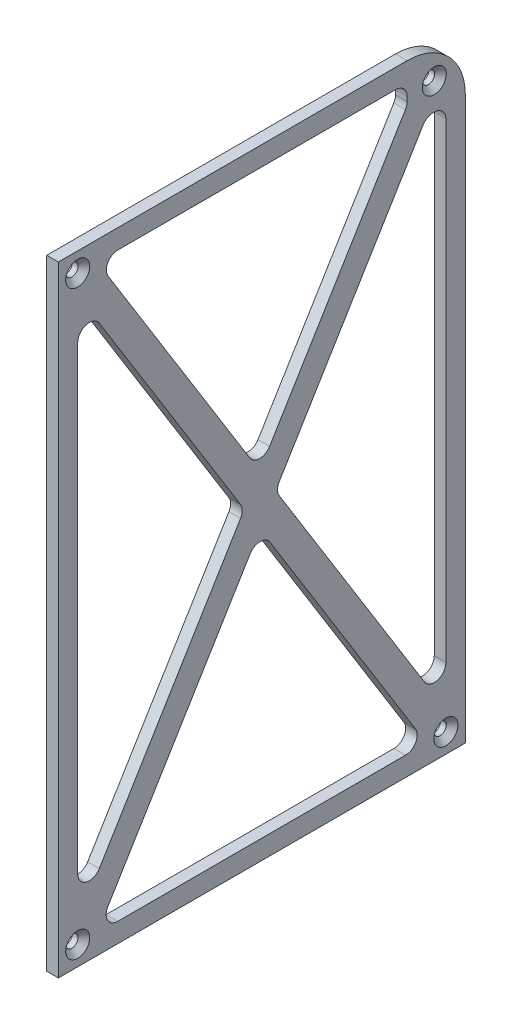
from build123d import *

# Parameters (mm, degrees)
SKETCH1_R           = 1.6
BOSS_EXTRUDE2_DEPTH = 3
FILLET1_R           = 3
CHAMFER1_SIZE       = 1.5


with BuildPart() as part:
    # Sketch1 → Boss-Extrude2 (new body)
    with BuildSketch(Plane(origin=(0, 0, 0), x_dir=(0, 0, -1), z_dir=(1, 0, 0))):
        with BuildLine():
            Line((0, 160), (0, 0))
            Line((0, 0), (105, 0))
            Line((105, 0), (105, 145))
            ThreePointArc((105, 145), (100.606601718, 155.606601718), (90, 160))
            Line((90, 160), (0, 160))
        make_face()
        with BuildLine():
            ThreePointArc((6.6, 5), (3.86862915, 3.86862915), (5, 6.6))
            ThreePointArc((5, 6.6), (6.13137085, 6.13137085), (6.6, 5))
        make_face(mode=Mode.SUBTRACT)
        Polygon((47.96890672, 80.772316951), (5, 10), (5, 150), align=None, mode=Mode.SUBTRACT)
        Polygon((95, 5), (10, 5), (52.03109328, 74.227683049), align=None, mode=Mode.SUBTRACT)
        with BuildLine():
            ThreePointArc((98.4, 5), (98.86862915, 6.13137085), (100, 6.6))
            ThreePointArc((100, 6.6), (101.13137085, 6.13137085), (101.6, 5))
            ThreePointArc((101.6, 5), (100, 3.4), (98.4, 5))
        make_face(mode=Mode.SUBTRACT)
        Polygon((100, 145), (100, 10), (56.038114343, 80.827482447), (95, 145), align=None, mode=Mode.SUBTRACT)
        with BuildLine():
            ThreePointArc((5, 153.4), (3.86862915, 156.13137085), (6.6, 155))
            ThreePointArc((6.6, 155), (6.13137085, 153.86862915), (5, 153.4))
        make_face(mode=Mode.SUBTRACT)
        Polygon((51.975927783, 87.372116349), (10, 155), (90, 155), (90, 150), align=None, mode=Mode.SUBTRACT)
        with Locations((97, 152)):
            Circle(SKETCH1_R, mode=Mode.SUBTRACT)
    extrude(amount=BOSS_EXTRUDE2_DEPTH)

    # Fillet1
    fillet1_edges = [part.edges().sort_by_distance(p)[0] for p in [
        (1.5, 10, -100),
        (1.5, 150, -5),
        (1.5, 145, -100),
        (1.5, 155, -90),
        (1.5, 10, -5),
        (1.5, 5, -10),
        (1.5, 5, -95),
        (1.5, 155, -10),
        (1.5, 150, -90),
        (1.5, 145, -95),
        (1.5, 80.772316951, -47.96890672),
        (1.5, 74.227683049, -52.03109328),
        (1.5, 80.827482447, -56.038114343),
        (1.5, 87.372116349, -51.975927783),
    ]]
    fillet(fillet1_edges, radius=FILLET1_R)

    # Chamfer1
    chamfer1_edges = [part.edges().sort_by_distance(p)[0] for p in [
        (3, 5, -101.6),
        (3, 3.4, -5),
        (3, 152, -95.4),
        (3, 155, -3.4),
    ]]
    chamfer(chamfer1_edges, length=CHAMFER1_SIZE)


solid = part.part
